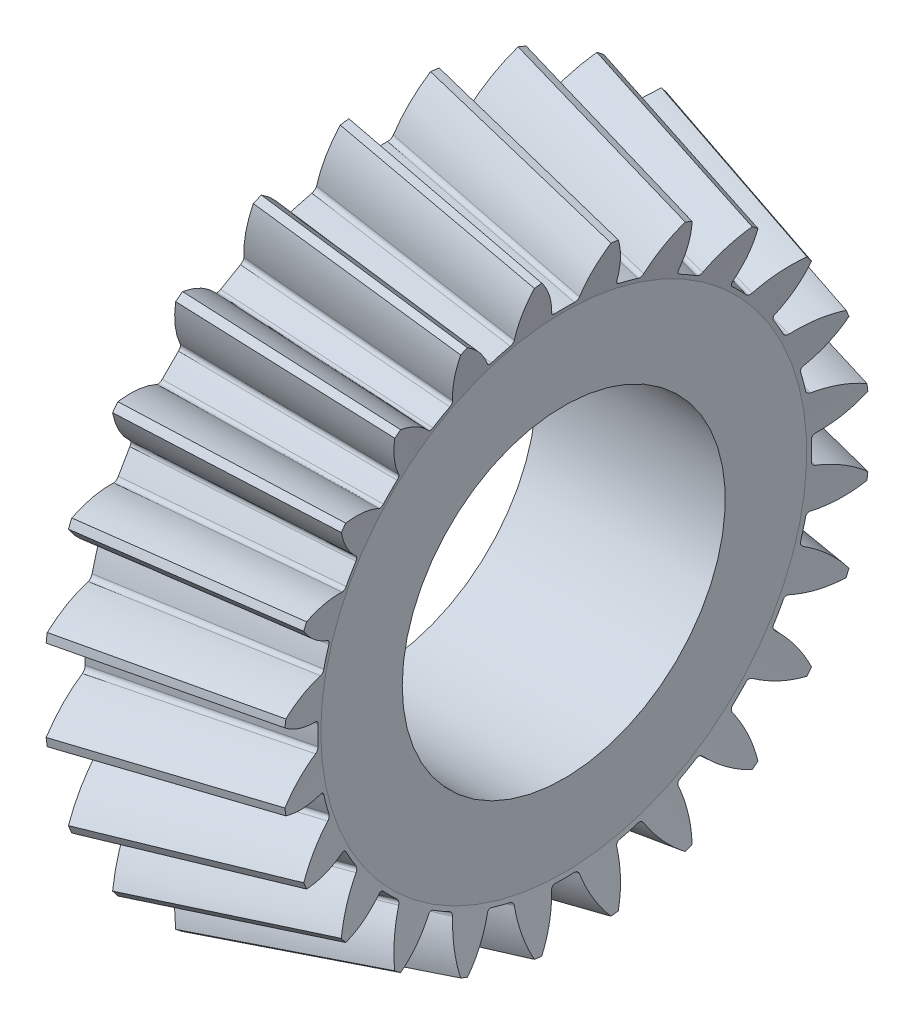
from build123d import *

# Parameters (mm, degrees)
TOOCUTSKE2_R    = 0.0127
TEETHCUTS_COUNT = 24
TEETHCUTS_ANGLE = 345
HUBSKE_R        = 12.5
HUB_DEPTH       = 0.0001016
BORSKE_R        = 12.5
BORE_DEPTH      = 96.459201055


with BuildPart() as part:
    # BasProSke → Base-Revolve (revolve)
    with BuildSketch(Plane(origin=(0, 0, 0), x_dir=(1, 0, 0), z_dir=(0, 1, 0)), mode=Mode.PRIVATE) as base_revolve_sk:
        Polygon((0, 0), (0, 22.16339898), (1.153408483, 26.777032906), (15.600307013, 22.718042644), (14.621737685, 18.803765336), (14.621737685, 0), align=None)
    revolve(base_revolve_sk.sketch.rotate(Axis((-10, 0, 0), (1, 0, 0)), 180), axis=Axis((-10, 0, 0), (1, 0, 0)))

    # TooCutSke2 → ToothCut section 0
    with BuildSketch(Plane(origin=(90.785082581, -22.696270672, 0), x_dir=(0, 0, 1), z_dir=(-0.9701425000774407, 0.2425356253078979, 0))):
        with Locations((0, 23.394780296)):
            Circle(TOOCUTSKE2_R)
    # TooCutSke → ToothCut section 1
    with BuildSketch(Plane(origin=(0.576704242, 24.470215943, 0), x_dir=(0, 0, -1), z_dir=(-0.9701425000774406, 0.24253562530789788, 0))):
        with BuildLine():
            ThreePointArc((-3.578704394, -2.68034839), (0, -2.9150625), (3.578704394, -2.68034839))
            ThreePointArc((3.578704394, -2.68034839), (2.134523209, -0.630878773), (1.27026106, 1.722636883))
            ThreePointArc((1.27026106, 1.722636883), (1.132131673, 1.938945165), (0.88754737, 2.016710957))
            ThreePointArc((0.88754737, 2.016710957), (0, 1.9991875), (-0.88754737, 2.016710957))
            ThreePointArc((-0.88754737, 2.016710957), (-1.132131673, 1.938945165), (-1.27026106, 1.722636883))
            ThreePointArc((-1.27026106, 1.722636883), (-2.134523209, -0.630878773), (-3.578704394, -2.68034839))
        make_face()
    toothcut = loft(mode=Mode.SUBTRACT)

    # TeethCuts: ToothCut ×24 about axis
    teethcuts_axis = Axis((-10, 0, 0), (1, 0, 0))
    for i in range(1, TEETHCUTS_COUNT):
        add(toothcut.rotate(teethcuts_axis, i * TEETHCUTS_ANGLE / (TEETHCUTS_COUNT - 1)), mode=Mode.SUBTRACT)

    # HubSke → Hub (add)
    with BuildSketch(Plane.ZY):
        with Locations(Location((0, 0, 0), (0, 0, 180))):
            Circle(HUBSKE_R)
    extrude(amount=HUB_DEPTH)

    # BorSke → Bore (cut, symmetric)
    with BuildSketch(Plane(origin=(0, 0, 0), x_dir=(0, 0, -1), z_dir=(1, 0, 0))):
        with Locations(Location((0, 0, 0), (0, 0, 180))):
            Circle(BORSKE_R)
    extrude(amount=BORE_DEPTH, both=True, mode=Mode.SUBTRACT)


solid = part.part
